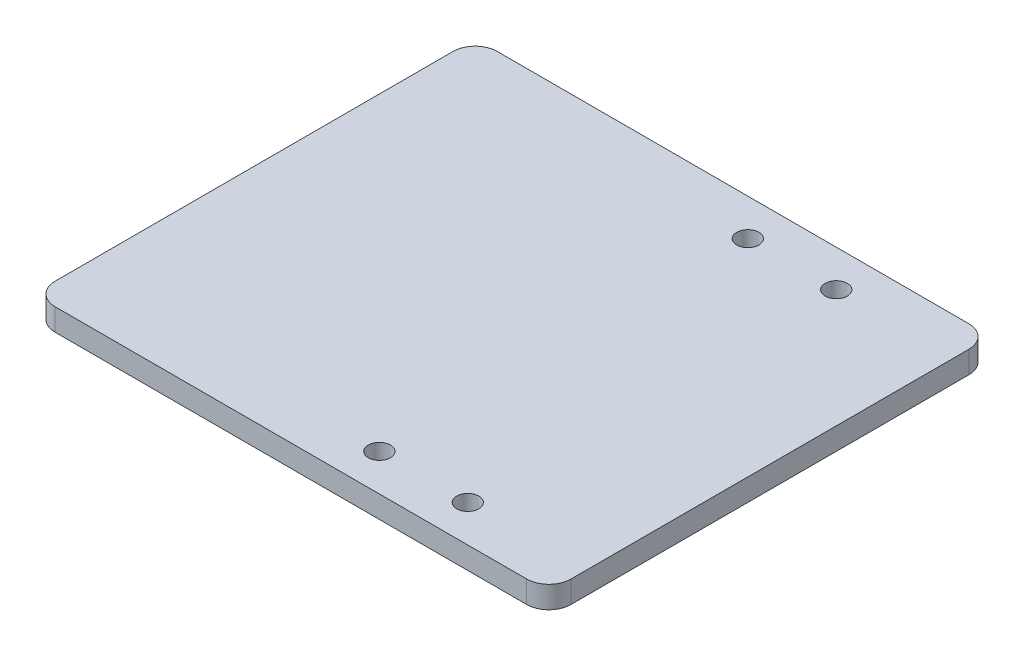
from build123d import *

# Parameters (mm, degrees)
SKETCH_1_W          = 70
SKETCH_1_H          = 60
EXTRUDE_1_DEPTH     = 3
SKETCH_2_R          = 1.5
CUT_EXTRUDE_1_DEPTH = 93.244241013
FILLET_1_R          = 3


with BuildPart() as part:
    # 草图1 → 凸台-拉伸1 (new body)
    with BuildSketch(Plane(origin=(0, 0, 0), x_dir=(1, 0, 0), z_dir=(0, 1, 0))):
        with Locations((35, -30)):
            Rectangle(SKETCH_1_W, SKETCH_1_H)
    extrude(amount=EXTRUDE_1_DEPTH)

    # 草图2 → 切除-拉伸1 (cut, through all)
    with BuildSketch(Plane(origin=(0, 3, 0), x_dir=(1, 0, 0), z_dir=(0, 1, 0))):
        with Locations((54, -5)):
            Circle(SKETCH_2_R)
        with Locations((42, -5)):
            Circle(SKETCH_2_R)
        with Locations((54, -55)):
            Circle(SKETCH_2_R)
        with Locations((42, -55)):
            Circle(SKETCH_2_R)
    extrude(amount=-CUT_EXTRUDE_1_DEPTH, mode=Mode.SUBTRACT)

    # 圆角1
    fillet_1_edges = [part.edges().sort_by_distance(p)[0] for p in [
        (0, 1.5, 60),
        (0, 1.5, 0),
        (70, 1.5, 0),
        (70, 1.5, 60),
    ]]
    fillet(fillet_1_edges, radius=FILLET_1_R)


solid = part.part
